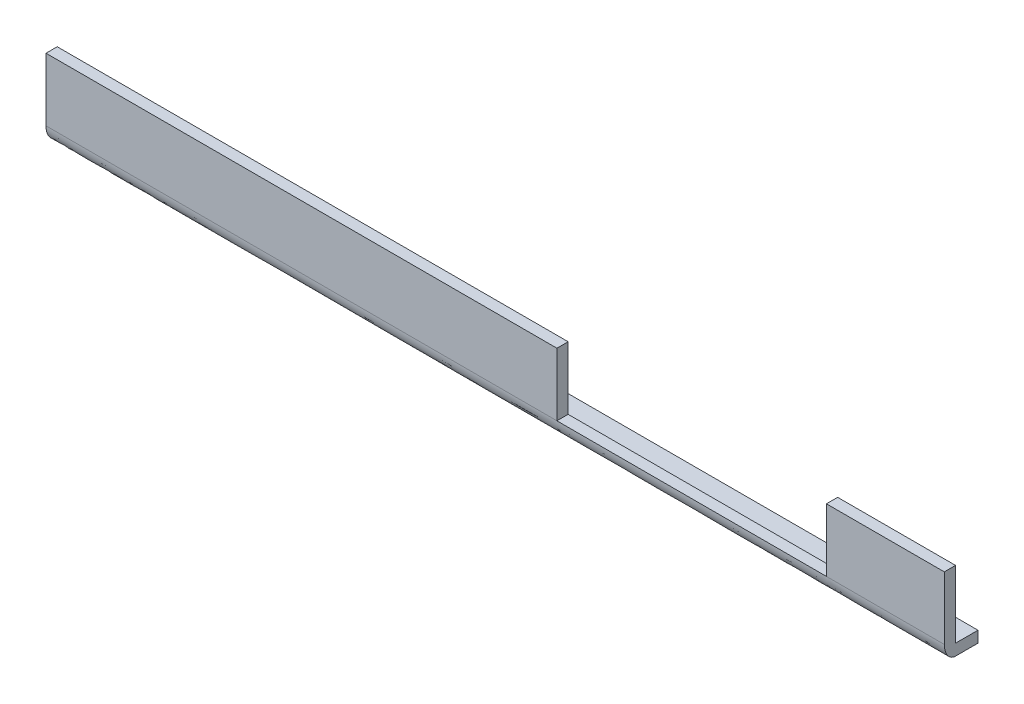
from build123d import *

# Parameters (mm, degrees)
SKETCH_1_W              = 400
SKETCH_1_H              = 35
EXTRUDE_1_DEPTH         = 5
SKETCH_2_W              = 400
SKETCH_2_H              = 5
EXTRUDE_2_DEPTH         = 10
FILLET_1_SIZE           = 7
FILLET_1_SIZE_2         = 5
CUT_EXTRUDE_START       = -5
CUT_EXTRUDE_1_OUTLINE_W = 120
CUT_EXTRUDE_1_OUTLINE_H = 28
CUT_EXTRUDE_1_DEPTH     = 5


# Read off the part's stored shape, not the designer's step: 切除-拉伸1
with BuildPart() as part:
    # 草图1 → 凸台-拉伸1 (new body)
    with BuildSketch(Plane.XY):
        with Locations((32.704402516, 130.419346185)):
            Rectangle(SKETCH_1_W, SKETCH_1_H)
    extrude(amount=EXTRUDE_1_DEPTH)

    # 草图2 → 凸台-拉伸2 (add)
    with BuildSketch(Plane(origin=(0, 0, 0), x_dir=(-1, 0, 0), z_dir=(0, 0, -1))):
        with Locations((-32.704402516, 115.419346185)):
            Rectangle(SKETCH_2_W, SKETCH_2_H)
    extrude(amount=EXTRUDE_2_DEPTH)

    # 圆角1
    # an asymmetric fillet: 7, 5 mm, written as the material it takes off along each edge
    with BuildSketch(Plane(origin=(250.204402516, 112.919346185, 5), x_dir=(0, 1, 0), z_dir=(-1, 0, 0))) as fillet_1_piece_1:
        with BuildLine():
            Bezier((FILLET_1_SIZE, 0), (0, 0), (0, FILLET_1_SIZE_2), weights=[1, 0.707106781, 1])
            Line((0, FILLET_1_SIZE_2), (0, 0))
            Line((0, 0), (FILLET_1_SIZE, 0))
        make_face()
    extrude(amount=435, mode=Mode.SUBTRACT)

    # 切除-拉伸1 outline → 切除-拉伸1 (cut)
    with BuildSketch(Plane.XY.offset(5).offset(CUT_EXTRUDE_START)):
        with Locations((120.204402516, 133.919346185)):
            Rectangle(CUT_EXTRUDE_1_OUTLINE_W, CUT_EXTRUDE_1_OUTLINE_H)
    extrude(amount=CUT_EXTRUDE_1_DEPTH, mode=Mode.SUBTRACT)


solid = part.part
